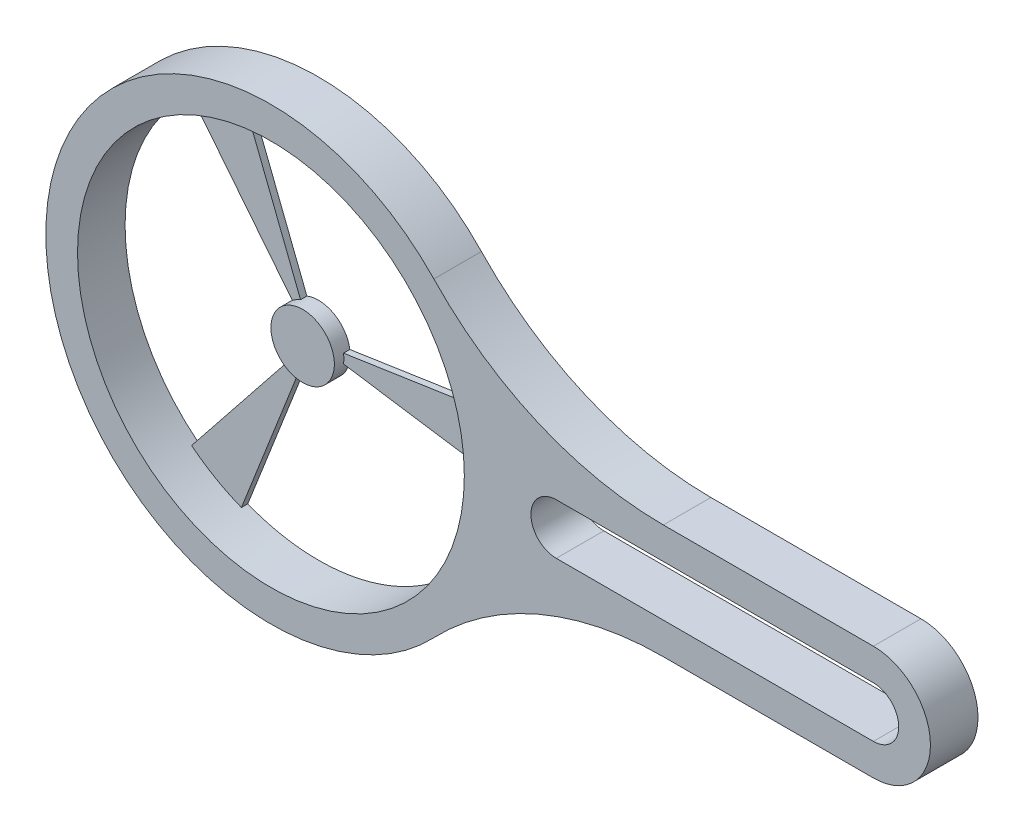
from build123d import *

# Parameters (mm, degrees)
BOSS_EXTRUDE1_DEPTH = 15
SKETCH2_R           = 10
BOSS_EXTRUDE2_DEPTH = 5
BOSS_EXTRUDE3_START = -2
BOSS_EXTRUDE3_DEPTH = 2


# Read off the part's stored shape, not the designer's step: Boss-Extrude3
with BuildPart() as part:
    # Sketch1 → Boss-Extrude1 (new body)
    # profile 1 of 3: a face of its own
    with BuildSketch(Plane.XY):
        with BuildLine():
            ThreePointArc((190, -18), (208, 0), (190, 18))
            Line((190, 18), (123.761868118, 18))
            ThreePointArc((123.761868118, 18), (84.395542377, 26.074528026), (51.386506645, 48.994152047))
            ThreePointArc((51.386506645, 48.994152047), (-71, 0), (51.386506645, -48.994152047))
            ThreePointArc((51.386506645, -48.994152047), (84.395542377, -26.074528026), (123.761868118, -18))
            Line((123.761868118, -18), (190, -18))
        make_face()
        with BuildLine():
            ThreePointArc((60.473134531, -8), (-61, 0), (60.473134531, 8))
            Line((60.473134531, 8), (90, 8))
            Line((90, 8), (190, 8))
            ThreePointArc((190, 8), (195.656854249, 5.656854249), (198, 0))
            ThreePointArc((198, 0), (195.656854249, -5.656854249), (190, -8))
            Line((190, -8), (90, -8))
            Line((90, -8), (60.473134531, -8))
        make_face(mode=Mode.SUBTRACT)
    # profile 2 of 3: a face of its own
    with BuildSketch(Plane.XY):
        with BuildLine():
            Line((82, 0), (61, 0))
            ThreePointArc((61, 0), (60.868141118, -4.008665215), (60.473134531, -8))
            Line((60.473134531, -8), (90, -8))
            ThreePointArc((90, -8), (84.343145751, -5.656854249), (82, 0))
        make_face()
    # profile 3 of 3: a face of its own
    with BuildSketch(Plane.XY):
        with BuildLine():
            ThreePointArc((60.473134531, 8), (60.868141118, 4.008665215), (61, 0))
            Line((61, 0), (82, 0))
            ThreePointArc((82, 0), (84.343145751, 5.656854249), (90, 8))
            Line((90, 8), (60.473134531, 8))
        make_face()
    extrude(amount=BOSS_EXTRUDE1_DEPTH)



with BuildPart() as body_2:
    # Sketch2 → Boss-Extrude2 (new body)
    with BuildSketch(Plane(origin=(0, 0, 0), x_dir=(-1, 0, 0), z_dir=(0, 0, -1))):
        Circle(SKETCH2_R)
    extrude(amount=-BOSS_EXTRUDE2_DEPTH)


with BuildPart() as part_1:
    add(part.part)

    add(body_2.part)  # Boss-Extrude3 merges body 2
    # Boss-Extrude3 outline → Boss-Extrude3 (add)
    with BuildSketch(Plane(origin=(0, 0, 0), x_dir=(-1, 0, 0), z_dir=(0, 0, -1)).offset(BOSS_EXTRUDE3_START)):
        with BuildLine():
            ThreePointArc((3.656966593, 9.307340938), (5.000741635, 8.659825812), (6.233249816, 7.819628938))
            Line((6.233249816, 7.819628938), (38.020298491, 47.701749471))
            ThreePointArc((38.020298491, 47.701749471), (34.356234784, 50.404852261), (30.500749997, 52.827116613))
            ThreePointArc((30.500749997, 52.827116613), (26.47526514, 54.954932207), (22.302277601, 56.776553063))
            Line((22.302277601, 56.776553063), (3.656966593, 9.307340938))
        make_face()
        with BuildLine():
            Line((38.020298491, -47.701749471), (6.233249816, -7.819628938))
            ThreePointArc((6.233249816, -7.819628938), (5.000741635, -8.659825812), (3.656966593, -9.307340938))
            Line((3.656966593, -9.307340938), (22.302277601, -56.776553063))
            ThreePointArc((22.302277601, -56.776553063), (26.475265139, -54.954932207), (30.500749997, -52.827116613))
            ThreePointArc((30.500749997, -52.827116613), (34.356234784, -50.404852261), (38.020298491, -47.701749471))
        make_face()
        with BuildLine():
            ThreePointArc((-9.888716443, -1.487712038), (-10, 0), (-9.888716443, 1.487712038))
            Line((-9.888716443, 1.487712038), (-60.319576093, 9.074803592))
            ThreePointArc((-60.319576093, 9.074803592), (-60.828499924, 4.550079946), (-60.998499994, 0))
            ThreePointArc((-60.998499994, 0), (-60.828499924, -4.550079946), (-60.319576093, -9.074803592))
            Line((-60.319576093, -9.074803592), (-9.888716443, -1.487712038))
        make_face()
    extrude(amount=BOSS_EXTRUDE3_DEPTH)


solid = part_1.part
